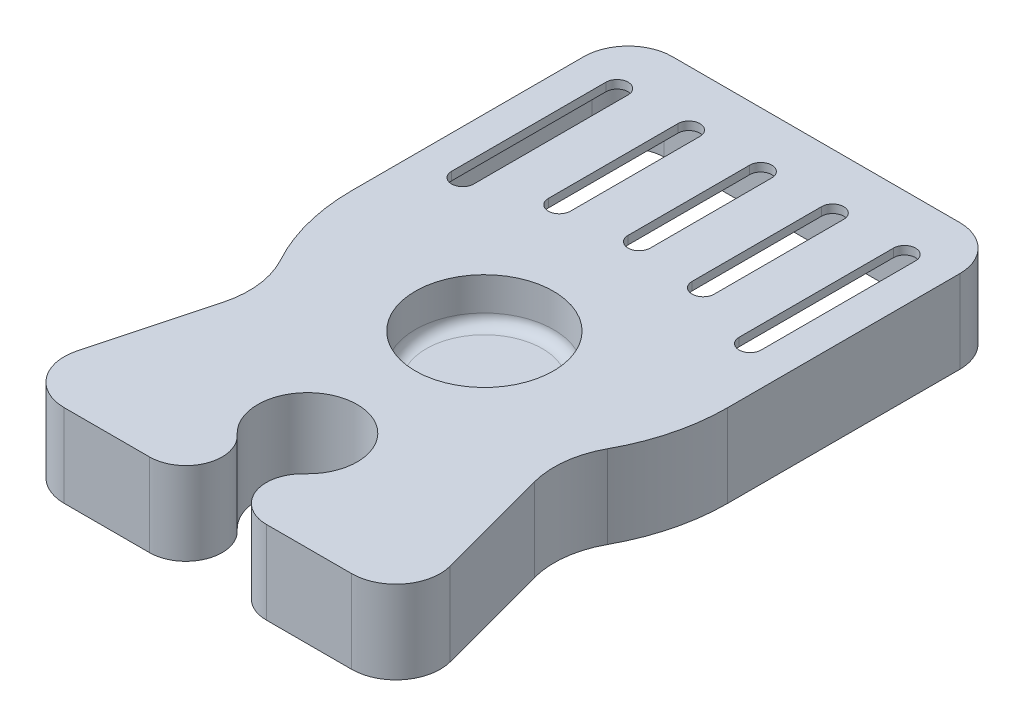
from build123d import *

# Parameters (mm, degrees)
SKETCH_1_R             = 12.5
EXTRUDE_1_DEPTH        = 15
SKETCH_1_3_R           = 12.5
CUT_EXTRUDE_1_DEPTH    = 8
FILLET_1_R             = 2
SHELL_1_T              = -1.5
CUT_EXTRUDE_2_DEPTH    = 8
PATTERN_START          = -1.5
PATTERN_LINEAR_6_DEPTH = 1.5


# Read off the part's stored shape, not the designer's step: 阵列(线性)6
with BuildPart() as part:
    # 草图1 → 凸台-拉伸1 (new body)
    # profile 1 of 2: a face of its own
    with BuildSketch(Plane(origin=(0, 0, 0), x_dir=(1, 0, 0), z_dir=(0, 1, 0))):
        with BuildLine():
            ThreePointArc((6.109515315, -38.6086173), (0, -23), (-6.109515315, -38.6086173))
            ThreePointArc((-6.109515315, -38.6086173), (-4.451858441, -45.825779601), (-10.568323275, -50))
            Line((-10.568323275, -50), (-26, -50))
            ThreePointArc((-26, -50), (-32.346826722, -46.870091432), (-33.72740661, -39.929447639))
            Line((-33.72740661, -39.929447639), (-28.151949957, -19.121560132))
            ThreePointArc((-28.151949957, -19.121560132), (-27.721159204, -13.070589863), (-29.573912969, -7.294161438))
            ThreePointArc((-29.573912969, -7.294161438), (-32.875929141, 1.074218994), (-34, 10))
            Line((-34, 10), (-34, 52))
            ThreePointArc((-34, 52), (-31.656854249, 57.656854249), (-26, 60))
            Line((-26, 60), (26, 60))
            ThreePointArc((26, 60), (31.656854249, 57.656854249), (34, 52))
            Line((34, 52), (34, 10))
            ThreePointArc((34, 10), (32.875929141, 1.074218994), (29.573912969, -7.294161438))
            ThreePointArc((29.573912969, -7.294161438), (27.721159204, -13.070589863), (28.151949957, -19.121560132))
            Line((28.151949957, -19.121560132), (33.72740661, -39.929447639))
            ThreePointArc((33.72740661, -39.929447639), (32.346826722, -46.870091432), (26, -50))
            Line((26, -50), (10.568323275, -50))
            ThreePointArc((10.568323275, -50), (4.451858441, -45.825779601), (6.109515315, -38.6086173))
        make_face()
        Circle(SKETCH_1_R, mode=Mode.SUBTRACT)
    # profile 2 of 2: a face of its own
    with BuildSketch(Plane(origin=(0, 0, 0), x_dir=(1, 0, 0), z_dir=(0, 1, 0))):
        Circle(SKETCH_1_R)
    extrude(amount=-EXTRUDE_1_DEPTH)

    # 草图1<3> → 切除-拉伸1 (cut)
    with BuildSketch(Plane(origin=(0, 0, 0), x_dir=(1, 0, 0), z_dir=(0, 1, 0))):
        with Locations(Location((0, 0, 0), (0, 0, 270))):
            Circle(SKETCH_1_3_R)
    extrude(amount=-CUT_EXTRUDE_1_DEPTH, mode=Mode.SUBTRACT)

    # 圆角1
    fillet_1_edges = [part.edges().sort_by_distance(p)[0] for p in [
        (0, -8, -12.5),
    ]]
    fillet(fillet_1_edges, radius=FILLET_1_R)

    # 抽壳1
    shell_1_openings = [part.faces().sort_by_distance(p)[0] for p in [
        (0, -15, -8.148675604),
    ]]
    offset(amount=SHELL_1_T, openings=shell_1_openings, kind=Kind.INTERSECTION)

    # 草图2 → 切除-拉伸2 (cut)
    with BuildSketch(Plane(origin=(0, 0, 0), x_dir=(1, 0, 0), z_dir=(0, 1, 0))):
        with BuildLine():
            Line((-28, 22.074023338), (-28, 50))
            ThreePointArc((-28, 50), (-26, 52), (-24, 50))
            Line((-24, 50), (-24, 22.074023338))
            ThreePointArc((-24, 22.074023338), (-26, 20.074023338), (-28, 22.074023338))
        make_face()
    extrude(amount=-CUT_EXTRUDE_2_DEPTH, mode=Mode.SUBTRACT)

    # 阵列(线性)6 outline → 阵列(线性)6 (cut)
    with BuildSketch(Plane(origin=(0, 0, 0), x_dir=(1, 0, 0), z_dir=(0, 1, 0)).offset(PATTERN_START)):
        with BuildLine():
            Line((24, 50), (24, 22.074023338))
            ThreePointArc((24, 22.074023338), (26, 20.074023338), (28, 22.074023338))
            Line((28, 22.074023338), (28, 50))
            ThreePointArc((28, 50), (26, 52), (24, 50))
        make_face()
        with BuildLine():
            Line((11, 50), (11, 26.574738582))
            ThreePointArc((11, 26.574738582), (13, 24.574738582), (15, 26.574738582))
            Line((15, 26.574738582), (15, 50))
            ThreePointArc((15, 50), (13, 52), (11, 50))
        make_face()
        with BuildLine():
            Line((-2, 50), (-2, 28))
            ThreePointArc((-2, 28), (0, 26), (2, 28))
            Line((2, 28), (2, 50))
            ThreePointArc((2, 50), (0, 52), (-2, 50))
        make_face()
        with BuildLine():
            Line((-15, 50), (-15, 26.574738582))
            ThreePointArc((-15, 26.574738582), (-13, 24.574738582), (-11, 26.574738582))
            Line((-11, 26.574738582), (-11, 50))
            ThreePointArc((-11, 50), (-13, 52), (-15, 50))
        make_face()
    extrude(amount=PATTERN_LINEAR_6_DEPTH, mode=Mode.SUBTRACT)


solid = part.part
